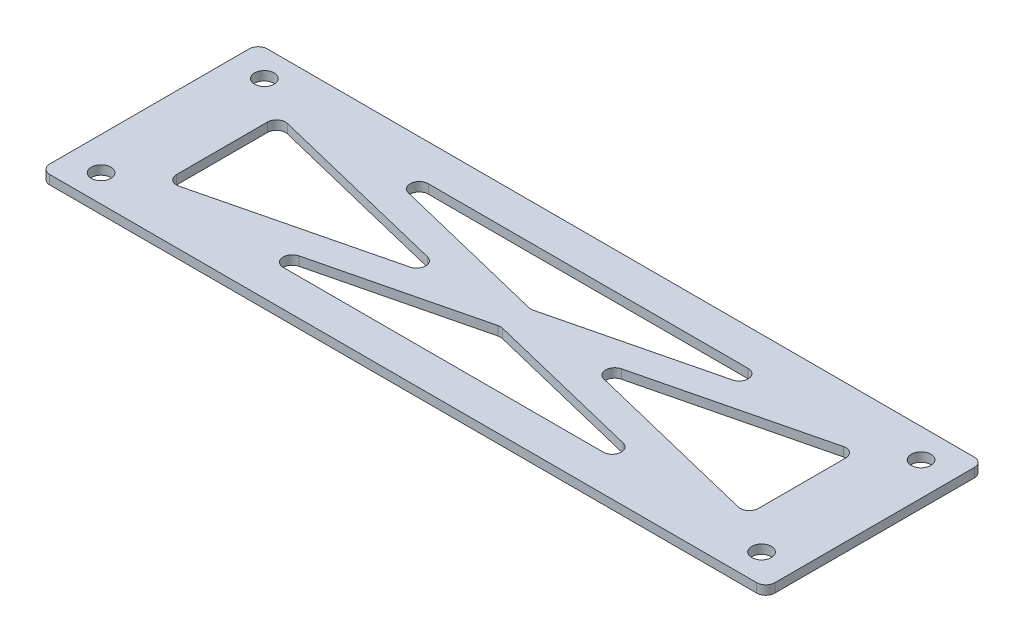
from build123d import *

# Parameters (mm, degrees)
SKETCH1_W           = 254
SKETCH1_H           = 76.2
SKETCH1_R           = 3.429
BOSS_EXTRUDE1_DEPTH = 3.175
FILLET1_R           = 3.175
CUT_EXTRUDE1_DEPTH  = 133.629900946
FILLET3_R           = 3.175


with BuildPart() as part:
    # Sketch1 → Boss-Extrude1 (new body)
    with BuildSketch(Plane(origin=(0, 0, 0), x_dir=(1, 0, 0), z_dir=(0, 1, 0))):
        Rectangle(SKETCH1_W, SKETCH1_H)
        with Locations((-115.350000059, 28.575)):
            Circle(SKETCH1_R, mode=Mode.SUBTRACT)
        with Locations((-115.350000059, -28.575)):
            Circle(SKETCH1_R, mode=Mode.SUBTRACT)
        with Locations((115.350000059, 27.94)):
            Circle(SKETCH1_R, mode=Mode.SUBTRACT)
        with Locations((115.350000059, -27.94)):
            Circle(SKETCH1_R, mode=Mode.SUBTRACT)
    extrude(amount=BOSS_EXTRUDE1_DEPTH)

    # Fillet1
    fillet1_edges = [part.edges().sort_by_distance(p)[0] for p in [
        (127, 1.5875, -38.1),
        (127, 1.5875, 38.1),
        (-127, 1.5875, -38.1),
        (-127, 1.5875, 38.1),
    ]]
    fillet(fillet1_edges, radius=FILLET1_R)

    # Sketch2 → Cut-Extrude1 (cut, through all)
    with BuildSketch(Plane(origin=(0, 3.175, 0), x_dir=(1, 0, 0), z_dir=(0, 1, 0))):
        Polygon((-20.054174536, 0), (-101.6, 19.976429665), (-101.6, -19.976429665), align=None)
        Polygon((83.631218775, 25.4), (-81.039083942, 25.4), (1.296067416, 5.23020773), align=None)
        Polygon((83.631218775, -25.4), (1.296067416, -5.23020773), (-81.039083942, -25.4), align=None)
        Polygon((101.6, 19.341429665), (22.646309369, 0), (101.6, -19.341429665), align=None)
    extrude(amount=-CUT_EXTRUDE1_DEPTH, mode=Mode.SUBTRACT)

    # Fillet3
    fillet3_edges = [part.edges().sort_by_distance(p)[0] for p in [
        (22.646309369, 1.5875, 0),
        (83.631218775, 1.5875, -25.4),
        (83.631218775, 1.5875, 25.4),
        (-81.039083942, 1.5875, 25.4),
        (-81.039083942, 1.5875, -25.4),
        (-20.054174536, 1.5875, 0),
        (101.6, 1.5875, -19.341429665),
        (101.6, 1.5875, 19.341429665),
        (-101.6, 1.5875, 19.976429665),
        (-101.6, 1.5875, -19.976429665),
        (1.296067416, 1.5875, -5.23020773),
        (1.296067416, 1.5875, 5.23020773),
    ]]
    fillet(fillet3_edges, radius=FILLET3_R)


solid = part.part
